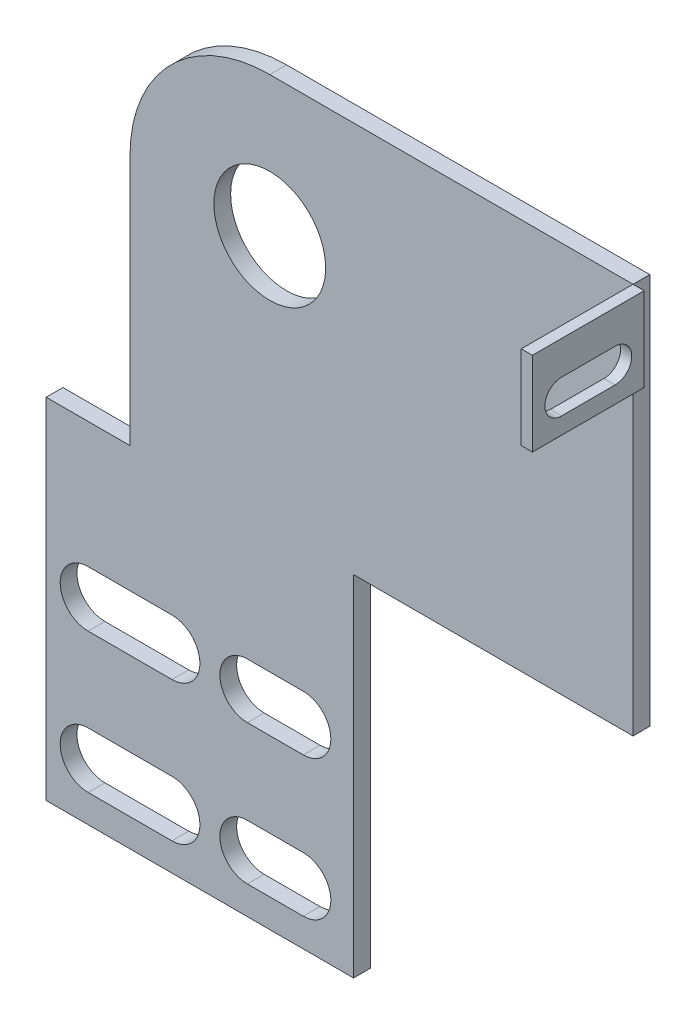
from build123d import *

# Parameters (mm, degrees)
SKETCH1_W           = 133.35
SKETCH1_H           = 168.275
BOSS_EXTRUDE1_DEPTH = 3.81
SKETCH2_OUTSIDE_W   = 178.298
SKETCH2_OUTSIDE_H   = 213.223
SKETCH2_OUTSIDE_R   = 12.7
CUT_EXTRUDE1_DEPTH  = 215.739875722
SKETCH3_W           = 25.4
SKETCH3_H           = 19.05
BOSS_EXTRUDE2_DEPTH = 2.54


with BuildPart() as part:
    # Sketch1 → Boss-Extrude1 (new body)
    with BuildSketch(Plane.XY):
        with Locations((66.675, 84.1375)):
            Rectangle(SKETCH1_W, SKETCH1_H)
    extrude(amount=BOSS_EXTRUDE1_DEPTH)

    # Sketch2 outside → Cut-Extrude1 (cut, through all)
    # profile 1 of 6: a face of its own
    with BuildSketch(Plane.XY):
        with Locations((66.675, 84.1375)):
            Rectangle(SKETCH2_OUTSIDE_W, SKETCH2_OUTSIDE_H)
        with BuildLine():
            Line((0, 79.375), (19.05, 79.375))
            Line((19.05, 79.375), (19.05, 136.525))
            ThreePointArc((19.05, 136.525), (28.349359697, 158.975640303), (50.8, 168.275))
            Line((50.8, 168.275), (133.35, 168.275))
            Line((133.35, 168.275), (133.35, 79.375))
            Line((133.35, 79.375), (69.85, 79.375))
            Line((69.85, 79.375), (69.85, 0))
            Line((69.85, 0), (0, 0))
            Line((0, 0), (0, 79.375))
        make_face(mode=Mode.SUBTRACT)
    # profile 2 of 6: a face of its own
    with BuildSketch(Plane.XY):
        with Locations((50.8, 136.525)):
            Circle(SKETCH2_OUTSIDE_R)
    # profile 3 of 6: a face of its own
    with BuildSketch(Plane.XY):
        with BuildLine():
            Line((9.525, 50.8), (28.575, 50.8))
            ThreePointArc((28.575, 50.8), (34.925, 44.45), (28.575, 38.1))
            Line((28.575, 38.1), (9.525, 38.1))
            ThreePointArc((9.525, 38.1), (3.175, 44.45), (9.525, 50.8))
        make_face()
    # profile 4 of 6: a face of its own
    with BuildSketch(Plane.XY):
        with BuildLine():
            Line((9.525, 19.05), (28.575, 19.05))
            ThreePointArc((28.575, 19.05), (34.925, 12.7), (28.575, 6.35))
            Line((28.575, 6.35), (9.525, 6.35))
            ThreePointArc((9.525, 6.35), (3.175, 12.7), (9.525, 19.05))
        make_face()
    # profile 5 of 6: a face of its own
    with BuildSketch(Plane.XY):
        with BuildLine():
            Line((45.72, 50.708973433), (58.42, 50.708973433))
            ThreePointArc((58.42, 50.708973433), (64.678973433, 44.45), (58.42, 38.191026567))
            Line((58.42, 38.191026567), (45.72, 38.191026567))
            ThreePointArc((45.72, 38.191026567), (39.461026567, 44.45), (45.72, 50.708973433))
        make_face()
    # profile 6 of 6: a face of its own
    with BuildSketch(Plane.XY):
        with BuildLine():
            Line((45.72, 18.958973433), (58.42, 18.958973433))
            ThreePointArc((58.42, 18.958973433), (64.678973433, 12.7), (58.42, 6.441026567))
            Line((58.42, 6.441026567), (45.72, 6.441026567))
            ThreePointArc((45.72, 6.441026567), (39.461026567, 12.7), (45.72, 18.958973433))
        make_face()
    extrude(amount=CUT_EXTRUDE1_DEPTH, mode=Mode.SUBTRACT)


with BuildPart() as body_2:
    # Sketch3 → Boss-Extrude2 (new body)
    with BuildSketch(Plane(origin=(133.35, 0, 0), x_dir=(0, 0, -1), z_dir=(1, 0, 0))):
        with Locations((-16.51, 158.75)):
            Rectangle(SKETCH3_W, SKETCH3_H)
        with BuildLine():
            Line((-22.572792052, 160.655), (-10.447207948, 160.655))
            ThreePointArc((-10.447207948, 160.655), (-6.637207948, 156.845), (-10.447207948, 153.035))
            Line((-10.447207948, 153.035), (-22.572792052, 153.035))
            ThreePointArc((-22.572792052, 153.035), (-26.382792052, 156.845), (-22.572792052, 160.655))
        make_face(mode=Mode.SUBTRACT)
    extrude(amount=BOSS_EXTRUDE2_DEPTH)


solid = Compound([part.part, body_2.part])
